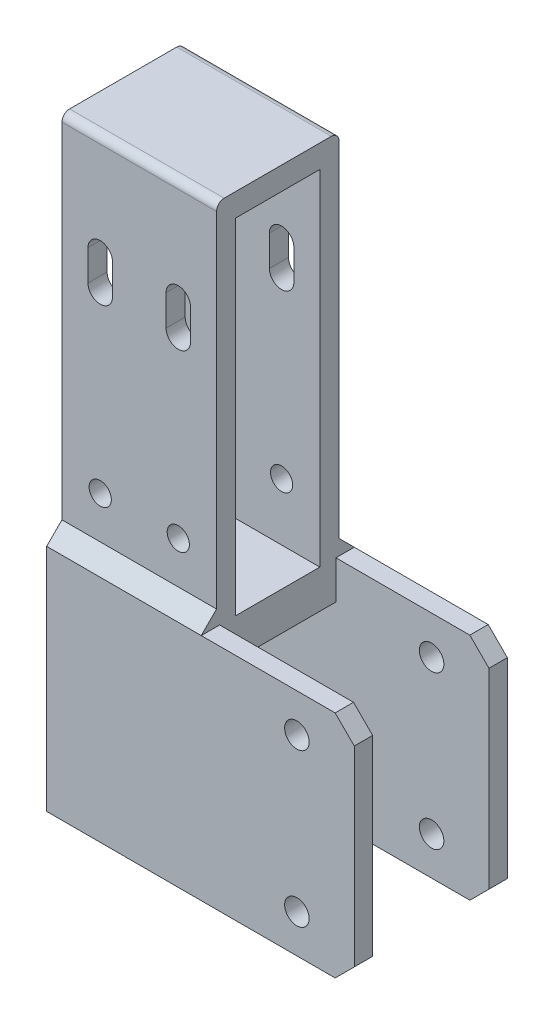
from build123d import *

# Parameters (mm, degrees)
EXTRUDE_1_DEPTH      = 30
SKETCH_2_W           = 20.2
SKETCH_2_H           = 50
EXTRUDE_1_2_DEPTH    = 20
SKETCH_3_W           = 20.2
SKETCH_3_H           = 11
CUT_EXTRUDE_1_DEPTH  = 20
CUT_EXTRUDE_2_REACH  = 60.432
SKETCH_4_W           = 11
SKETCH_4_H           = 20
SKETCH_5_W           = 20.2
SKETCH_5_H           = 4.5
EXTRUDE_2_DEPTH      = 25
CUT_EXTRUDE_4_REACH  = 80.275
CUT_EXTRUDE_5_REACH  = 82.278
SKETCH_9_R           = 1.6
SKETCH_10_W          = 20.2
SKETCH_10_H          = 20
EXTRUDE_3_DEPTH      = 3
CUT_EXTRUDE_6_REACH  = 55.965
SKETCH_12_W          = 20.2
SKETCH_12_H          = 30
EXTRUDE_4_DEPTH      = 2
SKETCH_13_W          = 20.2
SKETCH_13_H          = 30
EXTRUDE_5_DEPTH      = 2
CUT_EXTRUDE_START    = -20.2
SKETCH_15_W          = 15.2
SKETCH_15_H          = 20
CUT_EXTRUDE_7_DEPTH  = 20.2
SKETCH_16_W          = 4.4
SKETCH_16_H          = 30
SKETCH_16_W_2        = 5.4
EXTRUDE_6_DEPTH      = 20
CUT_EXTRUDE_8_REACH  = 88.983
SKETCH_17_R          = 1.6
CHAMFER_1_SIZE       = 2.5
CUT_EXTRUDE_9_REACH  = 89.122
SKETCH_18_W          = 46.30929367
SKETCH_18_H          = 3
SKETCH_20_W          = 20.2
SKETCH_20_H          = 20
EXTRUDE_7_DEPTH      = 2.1
SKETCH_21_W          = 20.2
SKETCH_21_H          = 20
EXTRUDE_8_DEPTH      = 2.1
SKETCH_22_W          = 46.206629154
SKETCH_22_H          = 1
CUT_EXTRUDE_10_DEPTH = 30
SKETCH_23_W          = 42.922328926
SKETCH_23_H          = 4
CUT_EXTRUDE_11_DEPTH = 30
CUT_EXTRUDE_12_REACH = 85.656
SKETCH_24_W          = 4
SKETCH_24_H          = 48
SKETCH_25_W          = 15.2
SKETCH_25_H          = 20
CUT_EXTRUDE_13_DEPTH = 20.2
SKETCH_26_W          = 20.2
SKETCH_26_H          = 20
EXTRUDE_9_DEPTH      = 1
CHAMFER_2_SIZE       = 2
FILLET_1_R           = 1
CUT_EXTRUDE_14_DEPTH = 1


with BuildPart() as part:
    # 草图1 → Extrude 1 (new body)
    with BuildSketch(Plane(origin=(0, 0, 0), x_dir=(1, 0, 0), z_dir=(0, 1, 0))):
        Polygon((-7.6, 15), (-7.6, 0), (7.6, 0), (7.6, 15), (10.1, 15), (10.1, -2.5), (-10.1, -2.5), (-10.1, 15), align=None)
    extrude(amount=EXTRUDE_1_DEPTH)

    # 草图2 → Extrude 1 2 (add)
    with BuildSketch(Plane.XY.offset(2.5)):
        with Locations((0, 25)):
            Rectangle(SKETCH_2_W, SKETCH_2_H)
    extrude(amount=EXTRUDE_1_2_DEPTH)

    # 草图3 → 切除-拉伸1 (cut)
    with BuildSketch(Plane(origin=(0, 50, 0), x_dir=(1, 0, 0), z_dir=(0, 1, 0))):
        with Locations((0, -12.5)):
            Rectangle(SKETCH_3_W, SKETCH_3_H)
    extrude(amount=-CUT_EXTRUDE_1_DEPTH, mode=Mode.SUBTRACT)

    # 草图4 → 切除-拉伸2 (cut, up to next)
    with BuildSketch(Plane(origin=(10.1, 0, 0), x_dir=(0, 0, -1), z_dir=(1, 0, 0)), mode=Mode.PRIVATE) as cut_extrude_2_sk1:
        with Locations((-12.5, 15)):
            Rectangle(SKETCH_4_W, SKETCH_4_H)
    cut_extrude_2_tool1 = extrude(cut_extrude_2_sk1.sketch, amount=-CUT_EXTRUDE_2_REACH, mode=Mode.PRIVATE) & part.part
    add(cut_extrude_2_tool1.solids().sort_by_distance((10.1, 15, 12.5))[0], mode=Mode.SUBTRACT)

    # 草图5 → 凸台-拉伸2 (add)
    with BuildSketch(Plane(origin=(0, 50, 0), x_dir=(1, 0, 0), z_dir=(0, 1, 0))):
        with Locations((0, -4.75)):
            Rectangle(SKETCH_5_W, SKETCH_5_H)
        with Locations((0, -20.25)):
            Rectangle(SKETCH_5_W, SKETCH_5_H)
    extrude(amount=EXTRUDE_2_DEPTH)

    # 草图7 → M3.5 螺纹孔1 (revolve, cut)
    with BuildSketch(Plane(origin=(-5.1, 37.5, 2.5), x_dir=(0, 1, 0), z_dir=(1, 0, 0))):
        Polygon((0, 0), (0, 40.871247898), (1.45, 40), (1.45, 0), align=None)
    hole_wizard_m3_5_1 = revolve(axis=Axis((-5.1, 37.5, -3.85), (0, 0, 1)), mode=Mode.SUBTRACT)

    # 切除-拉伸4: up to this face of the body (flat: up to its plane)
    cut_extrude_4_end = Plane(part.part.faces().sort_by_distance((0.022332689, 37.5, 22.5))[0])
    # 草图8 → 切除-拉伸4 (cut, up to the picked face)
    with BuildSketch(Plane(origin=(0, 0, 2.5), x_dir=(-1, 0, 0), z_dir=(0, 0, -1)), mode=Mode.PRIVATE) as cut_extrude_4_sk1:
        with BuildLine():
            Line((3.5, 60.5), (3.5, 64.5))
            ThreePointArc((3.5, 64.5), (5.1, 66.1), (6.7, 64.5))
            Line((6.7, 64.5), (6.7, 60.5))
            ThreePointArc((6.7, 60.5), (5.1, 58.9), (3.5, 60.5))
        make_face()
    cut_extrude_4_tool1 = split(extrude(cut_extrude_4_sk1.sketch, amount=-CUT_EXTRUDE_4_REACH, mode=Mode.PRIVATE), bisect_by=cut_extrude_4_end, keep=Keep.BOTH, mode=Mode.PRIVATE)
    cut_extrude_4 = cut_extrude_4_tool1.solids().sort_by(Axis((-5.1, 62.5, 2.5), (0, 0, 1)))[0]
    add(cut_extrude_4, mode=Mode.SUBTRACT)

    # 草图9 → 切除-拉伸5 (cut, up to next)
    with BuildSketch(Plane(origin=(-7.6, 0, 0), x_dir=(0, 0, -1), z_dir=(1, 0, 0)), mode=Mode.PRIVATE) as cut_extrude_5_sk1:
        with Locations((7.5, 25)):
            Circle(SKETCH_9_R)
    cut_extrude_5_tool1 = extrude(cut_extrude_5_sk1.sketch, amount=-CUT_EXTRUDE_5_REACH, mode=Mode.PRIVATE) & part.part
    # 草图9 → 切除-拉伸5 (cut, up to next)
    with BuildSketch(Plane(origin=(-7.6, 0, 0), x_dir=(0, 0, -1), z_dir=(1, 0, 0)), mode=Mode.PRIVATE) as cut_extrude_5_sk2:
        with Locations((7.5, 5)):
            Circle(SKETCH_9_R)
    cut_extrude_5_tool2 = extrude(cut_extrude_5_sk2.sketch, amount=-CUT_EXTRUDE_5_REACH, mode=Mode.PRIVATE) & part.part
    cut_extrude_5_1 = cut_extrude_5_tool1.solids().sort_by_distance((-7.6, 25, -7.5))[0]
    add(cut_extrude_5_1, mode=Mode.SUBTRACT)
    cut_extrude_5_2 = cut_extrude_5_tool2.solids().sort_by_distance((-7.6, 5, -7.5))[0]
    add(cut_extrude_5_2, mode=Mode.SUBTRACT)
    cut_extrude_5 = cut_extrude_5_1 + cut_extrude_5_2  # 切除-拉伸5 as one shape, for the pattern or mirror that repeats it

    # 镜向1: M3.5 螺纹孔1, 切除-拉伸4, 切除-拉伸5 across plane
    add(hole_wizard_m3_5_1.mirror(Plane(origin=(0, 0, 0), x_dir=(0, 0, 1), z_dir=(1, 0, 0))), mode=Mode.SUBTRACT)
    add(cut_extrude_4.mirror(Plane(origin=(0, 0, 0), x_dir=(0, 0, 1), z_dir=(1, 0, 0))), mode=Mode.SUBTRACT)
    add(cut_extrude_5.mirror(Plane(origin=(0, 0, 0), x_dir=(0, 0, 1), z_dir=(1, 0, 0))), mode=Mode.SUBTRACT)

    # 草图10 → 凸台-拉伸3 (add)
    with BuildSketch(Plane(origin=(0, 75, 0), x_dir=(1, 0, 0), z_dir=(0, 1, 0))):
        with Locations((0, -12.5)):
            Rectangle(SKETCH_10_W, SKETCH_10_H)
    extrude(amount=EXTRUDE_3_DEPTH)

    # 草图11 → 切除-拉伸6 (cut, up to next)
    with BuildSketch(Plane(origin=(0, 30, 0), x_dir=(1, 0, 0), z_dir=(0, 1, 0)), mode=Mode.PRIVATE) as cut_extrude_6_sk1:
        Polygon((10.1, -2.5), (10.1, 15), (7.6, 15), (7.6, 0), (-7.6, 0), (-7.6, 15), (-10.1, 15), (-10.1, -2.5), align=None)
    cut_extrude_6_tool1 = extrude(cut_extrude_6_sk1.sketch, amount=-CUT_EXTRUDE_6_REACH, mode=Mode.PRIVATE) & part.part
    add(cut_extrude_6_tool1.solids().sort_by_distance((9.832738, 30, -6.25))[0], mode=Mode.SUBTRACT)

    # 草图12 → 凸台-拉伸4 (add)
    with BuildSketch(Plane.XY.offset(22.5)):
        with Locations((0, 15)):
            Rectangle(SKETCH_12_W, SKETCH_12_H)
    extrude(amount=EXTRUDE_4_DEPTH)

    # 草图13 → 凸台-拉伸5 (add)
    with BuildSketch(Plane(origin=(0, 0, 2.5), x_dir=(-1, 0, 0), z_dir=(0, 0, -1))):
        with Locations((0, 15)):
            Rectangle(SKETCH_13_W, SKETCH_13_H)
    extrude(amount=EXTRUDE_5_DEPTH)

    # 草图15 → 切除-拉伸7 (cut)
    with BuildSketch(Plane(origin=(10.1, 0, 0), x_dir=(0, 0, -1), z_dir=(1, 0, 0)).offset(CUT_EXTRUDE_START)):
        with Locations((-12.5, 15)):
            Rectangle(SKETCH_15_W, SKETCH_15_H)
    extrude(amount=CUT_EXTRUDE_7_DEPTH, mode=Mode.SUBTRACT)

    # 草图16 → 凸台-拉伸6 (add)
    with BuildSketch(Plane(origin=(10.1, 0, 0), x_dir=(0, 0, -1), z_dir=(1, 0, 0))):
        with Locations((-22.3, 15)):
            Rectangle(SKETCH_16_W, SKETCH_16_H)
        with Locations((-3.2, 15)):
            Rectangle(SKETCH_16_W_2, SKETCH_16_H)
    extrude(amount=EXTRUDE_6_DEPTH)

    # 切除-拉伸8: up to this face of the body (flat: up to its plane)
    cut_extrude_8_end = Plane(part.part.faces().sort_by_distance((10, 15, 0.5))[0])
    # 草图17 → 切除-拉伸8 (cut, up to the picked face)
    with BuildSketch(Plane.XY.offset(24.5), mode=Mode.PRIVATE) as cut_extrude_8_sk1:
        with Locations((22.6, 25)):
            Circle(SKETCH_17_R)
    cut_extrude_8_tool1 = split(extrude(cut_extrude_8_sk1.sketch, amount=-CUT_EXTRUDE_8_REACH, mode=Mode.PRIVATE), bisect_by=cut_extrude_8_end, keep=Keep.BOTH, mode=Mode.PRIVATE)
    # 草图17 → 切除-拉伸8 (cut, up to the picked face)
    with BuildSketch(Plane.XY.offset(24.5), mode=Mode.PRIVATE) as cut_extrude_8_sk2:
        with Locations((22.6, 5)):
            Circle(SKETCH_17_R)
    cut_extrude_8_tool2 = split(extrude(cut_extrude_8_sk2.sketch, amount=-CUT_EXTRUDE_8_REACH, mode=Mode.PRIVATE), bisect_by=cut_extrude_8_end, keep=Keep.BOTH, mode=Mode.PRIVATE)
    add(cut_extrude_8_tool1.solids().sort_by(Axis((22.6, 25, 24.5), (0, 0, -1)))[0], mode=Mode.SUBTRACT)
    add(cut_extrude_8_tool2.solids().sort_by(Axis((22.6, 5, 24.5), (0, 0, -1)))[0], mode=Mode.SUBTRACT)

    # 倒角1
    chamfer_1_edges = [part.edges().sort_by_distance(p)[0] for p in [
        (30.1, 0, 22.3),
        (30.1, 0, 3.2),
        (30.1, 30, 3.2),
        (30.1, 30, 22.3),
    ]]
    chamfer(chamfer_1_edges, length=CHAMFER_1_SIZE)

    # 切除-拉伸9: up to this face of the body (flat: up to its plane)
    cut_extrude_9_end = Plane(part.part.faces().sort_by_distance((0, 78, 12.5))[0])
    # 草图18 → 切除-拉伸9 (cut, up to the picked face)
    with BuildSketch(Plane.XZ, mode=Mode.PRIVATE) as cut_extrude_9_sk1:
        with Locations((8.75, 0.5)):
            Rectangle(SKETCH_18_W, SKETCH_18_H)
    cut_extrude_9_tool1 = split(extrude(cut_extrude_9_sk1.sketch, amount=-CUT_EXTRUDE_9_REACH, mode=Mode.PRIVATE), bisect_by=cut_extrude_9_end, keep=Keep.BOTH, mode=Mode.PRIVATE)
    add(cut_extrude_9_tool1.solids().sort_by(Axis((8.75, 0, 0.5), (0, 1, 0)))[0], mode=Mode.SUBTRACT)

    # 草图20 → 凸台-拉伸7 (add)
    with BuildSketch(Plane.XY.offset(4.9)):
        with Locations((0, 15)):
            Rectangle(SKETCH_20_W, SKETCH_20_H)
    extrude(amount=EXTRUDE_7_DEPTH)

    # 草图21 → 凸台-拉伸8 (add)
    with BuildSketch(Plane(origin=(0, 0, 20.1), x_dir=(-1, 0, 0), z_dir=(0, 0, -1))):
        with Locations((0, 15)):
            Rectangle(SKETCH_21_W, SKETCH_21_H)
    extrude(amount=EXTRUDE_8_DEPTH)

    # 草图22 → 切除-拉伸10 (cut)
    with BuildSketch(Plane(origin=(0, 30, 0), x_dir=(1, 0, 0), z_dir=(0, 1, 0))):
        with Locations((8.75, -2)):
            Rectangle(SKETCH_22_W, SKETCH_22_H)
    extrude(amount=-CUT_EXTRUDE_10_DEPTH, mode=Mode.SUBTRACT)

    # 草图23 → 切除-拉伸11 (cut)
    with BuildSketch(Plane(origin=(0, 30, 0), x_dir=(1, 0, 0), z_dir=(0, 1, 0))):
        with Locations((8.75, -24.5)):
            Rectangle(SKETCH_23_W, SKETCH_23_H)
    extrude(amount=-CUT_EXTRUDE_11_DEPTH, mode=Mode.SUBTRACT)

    # 草图24 → 切除-拉伸12 (cut, up to next)
    with BuildSketch(Plane(origin=(10.1, 0, 0), x_dir=(0, 0, -1), z_dir=(1, 0, 0)), mode=Mode.PRIVATE) as cut_extrude_12_sk1:
        with Locations((-22.5, 54)):
            Rectangle(SKETCH_24_W, SKETCH_24_H)
    cut_extrude_12_tool1 = extrude(cut_extrude_12_sk1.sketch, amount=-CUT_EXTRUDE_12_REACH, mode=Mode.PRIVATE) & part.part
    # 草图24 → 切除-拉伸12 (cut, up to next)
    with BuildSketch(Plane(origin=(10.1, 0, 0), x_dir=(0, 0, -1), z_dir=(1, 0, 0)), mode=Mode.PRIVATE) as cut_extrude_12_sk2:
        with Locations((-2.5, 54)):
            Rectangle(SKETCH_24_W, SKETCH_24_H)
    cut_extrude_12_tool2 = extrude(cut_extrude_12_sk2.sketch, amount=-CUT_EXTRUDE_12_REACH, mode=Mode.PRIVATE) & part.part
    add(cut_extrude_12_tool1.solids().sort_by_distance((10.1, 54, 22.5))[0], mode=Mode.SUBTRACT)
    add(cut_extrude_12_tool2.solids().sort_by_distance((10.1, 54, 2.5))[0], mode=Mode.SUBTRACT)

    # 草图25 → 切除-拉伸13 (cut)
    with BuildSketch(Plane(origin=(10.1, 0, 0), x_dir=(0, 0, -1), z_dir=(1, 0, 0)).offset(CUT_EXTRUDE_START)):
        with Locations((-12.5, 15)):
            Rectangle(SKETCH_25_W, SKETCH_25_H)
    extrude(amount=CUT_EXTRUDE_13_DEPTH, mode=Mode.SUBTRACT)

    # 草图26 → 凸台-拉伸9 (add)
    with BuildSketch(Plane.XY.offset(4.9)):
        with Locations((0, 15)):
            Rectangle(SKETCH_26_W, SKETCH_26_H)
    extrude(amount=EXTRUDE_9_DEPTH)

    # 倒角2
    chamfer_2_edges = [part.edges().sort_by_distance(p)[0] for p in [
        (0, 30, 4.5),
        (0, 30, 20.5),
    ]]
    chamfer(chamfer_2_edges, length=CHAMFER_2_SIZE - 0.0001)  # a hair under: the kernel refuses the full size

    # 圆角1
    fillet_1_edges = [part.edges().sort_by_distance(p)[0] for p in [
        (0, 78, 20.5),
        (0, 78, 4.5),
    ]]
    fillet(fillet_1_edges, radius=FILLET_1_R)

    # 草图27 → 切除-拉伸14 (cut)
    with BuildSketch(Plane.XY.offset(5.9)):
        Polygon((10.1, 0), (27.6, 0), (30.1, 2.5), (30.1, 27.5), (27.6, 30), (10.1, 30), (10.1, 25), (-10.1, 25), (-10.1, 5), (10.1, 5), align=None)
    extrude(amount=-CUT_EXTRUDE_14_DEPTH, mode=Mode.SUBTRACT)


solid = part.part
